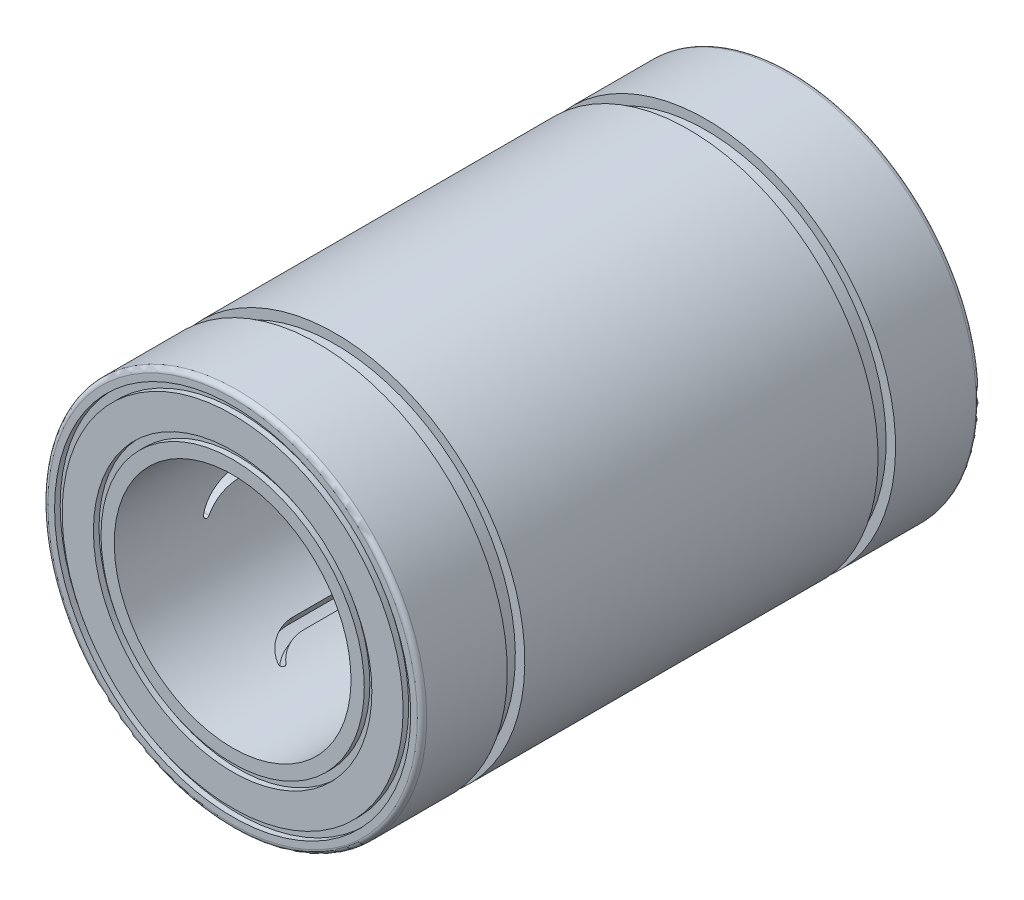
from build123d import *

# Parameters (mm, degrees)
SKETCH5_R               = 18.8
SKETCH5_R_2             = 18
SKETCH5_R_3             = 14.7
SKETCH5_R_4             = 13.9
CUT_EXTRUDE1_DEPTH      = 0.59
CUT_EXTRUDE3_REACH      = 42.869
CUT_EXTRUDE3_END_RADIUS = 13.75
CIRPATTERN3_COUNT       = 6
FILLET1_R               = 0.5


with BuildPart() as part:
    # Sketch4 → Revolve1 (revolve)
    with BuildSketch(Plane(origin=(0, 0, 0), x_dir=(0, 0, -1), z_dir=(1, 0, 0)), mode=Mode.PRIVATE) as revolve1_sk:
        Polygon((-29.5, 12.5), (-29.5, 20), (-20.5, 20), (-20.5, 19), (-18.65, 19), (-18.65, 20), (18.65, 20), (18.65, 19), (20.5, 19), (20.5, 20), (29.5, 20), (29.5, 12.5), align=None)
    revolve(revolve1_sk.sketch.rotate(Axis((0, 0, 29.5), (0, 0, -1)), 180), axis=Axis((0, 0, 29.5), (0, 0, -1)))

    # Sketch5 → Cut-Extrude1 (cut)
    # profile 1 of 2: a face of its own
    with BuildSketch(Plane.XY.offset(29.5)):
        Circle(SKETCH5_R)
        Circle(SKETCH5_R_2, mode=Mode.SUBTRACT)
    # profile 2 of 2: a face of its own
    with BuildSketch(Plane.XY.offset(29.5)):
        Circle(SKETCH5_R_3)
        Circle(SKETCH5_R_4, mode=Mode.SUBTRACT)
    cut_extrude1 = extrude(amount=-CUT_EXTRUDE1_DEPTH, mode=Mode.SUBTRACT)

    # Mirror1: Cut-Extrude1 across plane
    add(cut_extrude1.mirror(Plane.XY), mode=Mode.SUBTRACT)

    # Cut-Extrude3: up to this cylinder (the profile starts inside it)
    cut_extrude3_end = Plane(origin=(0, 0, 0), z_dir=(0, 0, 1)) * Cylinder(CUT_EXTRUDE3_END_RADIUS, 114.238, mode=Mode.PRIVATE)
    # Sketch7 → Cut-Extrude3 (cut, up to the surface)
    with BuildSketch(Plane(origin=(0, 0, 0), x_dir=(0, 0, -1), z_dir=(1, 0, 0)), mode=Mode.PRIVATE) as cut_extrude3_sk1:
        with BuildLine():
            Line((16.333333333, 0.635), (-16.333333333, 0.635))
            ThreePointArc((-16.333333333, 0.635), (-18.675147036, -0.074094953), (-20.23024361, -1.963163961))
            ThreePointArc((-20.23024361, -1.963163961), (-20.099420298, -2.353154435), (-19.69544338, -2.275630517))
            ThreePointArc((-19.69544338, -2.275630517), (-18.203858156, -1.067038732), (-16.333333333, -0.635))
            Line((-16.333333333, -0.635), (16.333333333, -0.635))
            ThreePointArc((16.333333333, -0.635), (18.203858156, -1.067038732), (19.69544338, -2.275630517))
            ThreePointArc((19.69544338, -2.275630517), (20.099420298, -2.353154435), (20.23024361, -1.963163961))
            ThreePointArc((20.23024361, -1.963163961), (18.675147036, -0.074094953), (16.333333333, 0.635))
        make_face()
    cut_extrude3_tool1 = extrude(cut_extrude3_sk1.sketch, amount=-CUT_EXTRUDE3_REACH, mode=Mode.PRIVATE) & cut_extrude3_end
    cut_extrude3 = cut_extrude3_tool1.solids().sort_by_distance((0, -0.118312, 0))[0]
    add(cut_extrude3, mode=Mode.SUBTRACT)

    # CirPattern3: Cut-Extrude3 ×6 about axis
    cirpattern3_axis = Axis((0, 0, 0), (0, 0, 1))
    for i in range(1, CIRPATTERN3_COUNT):
        add(cut_extrude3.rotate(cirpattern3_axis, i * 360 / CIRPATTERN3_COUNT), mode=Mode.SUBTRACT)

    # Fillet1
    fillet1_edges = [part.edges().sort_by_distance(p)[0] for p in [
        (0, 20, 29.5),
        (0, 20, -29.5),
    ]]
    fillet(fillet1_edges, radius=FILLET1_R)


solid = part.part
